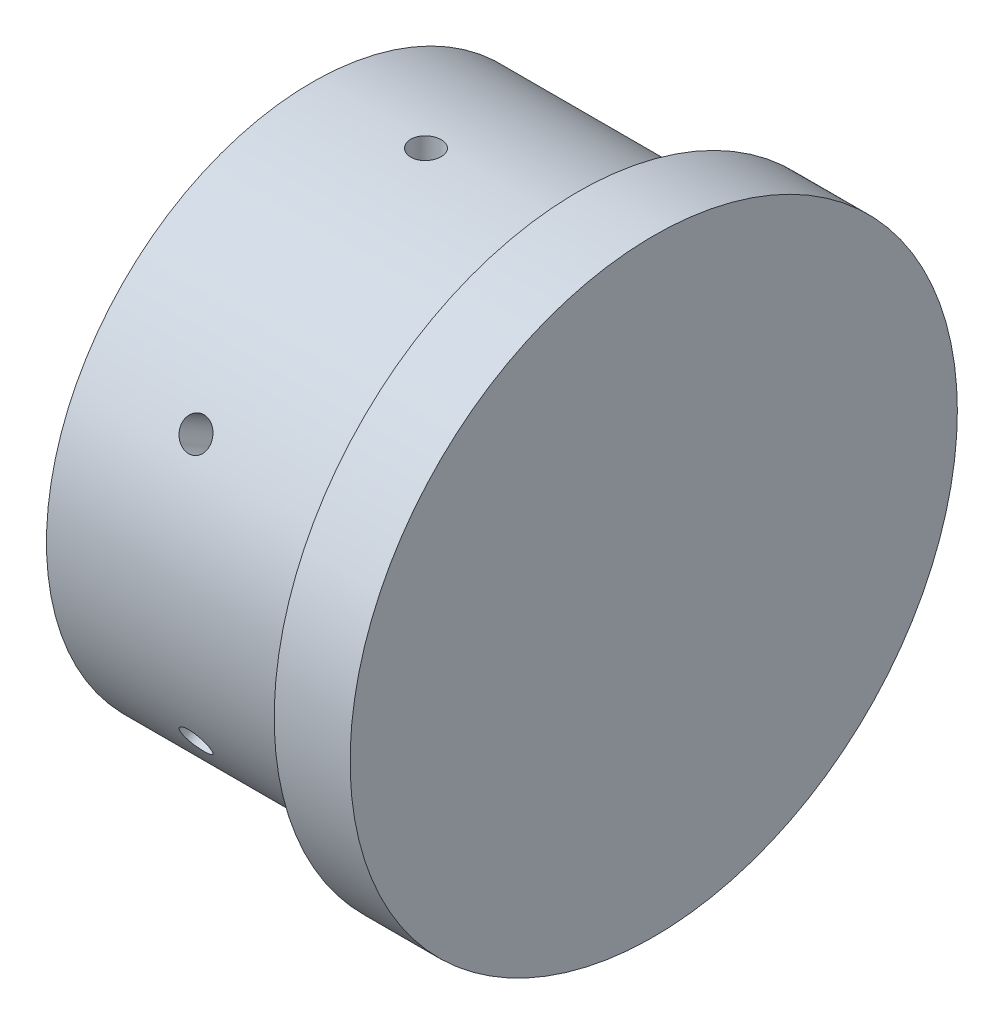
from build123d import *

# Parameters (mm, degrees)
SKETCH1_R           = 35
BOSS_EXTRUDE1_DEPTH = 35
SKETCH2_R           = 40
BOSS_EXTRUDE2_DEPTH = 10
SKETCH3_R           = 2
CUT_EXTRUDE1_DEPTH  = 10
CIRPATTERN1_COUNT   = 6


with BuildPart() as part:
    # Sketch1 → Boss-Extrude1 (new body)
    with BuildSketch(Plane(origin=(0, 0, 0), x_dir=(0, 0, -1), z_dir=(1, 0, 0))):
        Circle(SKETCH1_R)
    extrude(amount=BOSS_EXTRUDE1_DEPTH)

    # Sketch2 → Boss-Extrude2 (add)
    with BuildSketch(Plane(origin=(35, 0, 0), x_dir=(0, 0, -1), z_dir=(1, 0, 0))):
        Circle(SKETCH2_R)
    extrude(amount=BOSS_EXTRUDE2_DEPTH)

    # Sketch3 → Cut-Extrude1 (cut)
    with BuildSketch(Plane(origin=(0, 35, 0), x_dir=(1, 0, 0), z_dir=(0, 1, 0))):
        with Locations((15, 0)):
            Circle(SKETCH3_R)
    cut_extrude1 = extrude(amount=-CUT_EXTRUDE1_DEPTH, mode=Mode.SUBTRACT)

    # CirPattern1: Cut-Extrude1 ×6 about axis
    cirpattern1_axis = Axis((35, 0, 0), (-1, 0, 0))
    for i in range(1, CIRPATTERN1_COUNT):
        add(cut_extrude1.rotate(cirpattern1_axis, i * 360 / CIRPATTERN1_COUNT), mode=Mode.SUBTRACT)


solid = part.part
